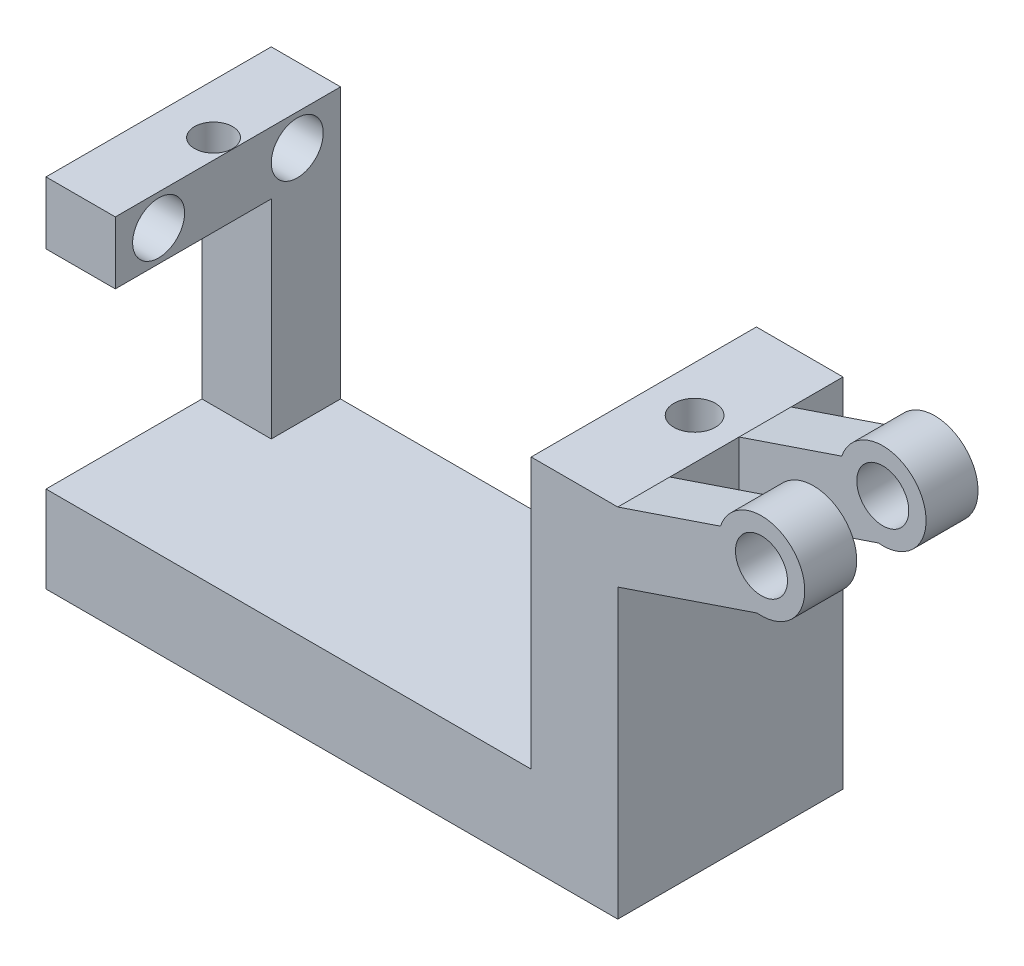
from build123d import *

# Parameters (mm, degrees)
BOSS_EXTRUDE1_DEPTH            = 13
SKETCH2_W                      = 9
SKETCH2_H                      = 12
CUT_EXTRUDE1_DEPTH             = 5
SKETCH3_R                      = 1.1
SKETCH3_R_2                    = 1.2
CUT_EXTRUDE2_DEPTH             = 5
SKETCH4_R                      = 1.5
BOSS_EXTRUDE3_DEPTH            = 3
BOSS_EXTRUDE4_START            = -6
BOSS_EXTRUDE4_OUTLINE_R        = 1.5
BOSS_EXTRUDE4_DEPTH            = 3
CUT_EXTRUDE3_REACH             = 53.746
SKETCH9_R                      = 1.5
CUT_EXTRUDE3_DIRECTION_2_DEPTH = 52.745889594
SKETCH10_W                     = 1
SKETCH10_H                     = 15.6
CUT_EXTRUDE5_DEPTH             = 39.790984582


# Read off the part's stored shape, not the designer's step: Boss-Extrude4
with BuildPart() as part:
    # Sketch1 → Boss-Extrude1 (new body)
    with BuildSketch(Plane.XY):
        Polygon((-11.5, 0), (11.5, 0), (16.5, 0), (16.5, 20.6), (11.5, 20.6), (11.5, 5), (-11.5, 5), (-11.5, 20.6), (-16.5, 20.6), (-16.5, 0), align=None)
    extrude(amount=BOSS_EXTRUDE1_DEPTH)

    # Sketch2 → Cut-Extrude1 (cut)
    with BuildSketch(Plane(origin=(-11.5, 0, 0), x_dir=(0, 0, -1), z_dir=(1, 0, 0))):
        with Locations((-8.5, 11)):
            Rectangle(SKETCH2_W, SKETCH2_H)
    extrude(amount=-CUT_EXTRUDE1_DEPTH, mode=Mode.SUBTRACT)

    # Sketch3 → Cut-Extrude2 (cut)
    with BuildSketch(Plane(origin=(0, 20.6, 0), x_dir=(1, 0, 0), z_dir=(0, 1, 0))):
        with Locations(Location((-13.63, -6.2, 0), (0, 0, 180))):
            Circle(SKETCH3_R)
        with Locations((14.132964109, -6.2)):
            Circle(SKETCH3_R_2)
    extrude(amount=-CUT_EXTRUDE2_DEPTH, mode=Mode.SUBTRACT)

    # Sketch4 → Boss-Extrude3 (add)
    with BuildSketch(Plane.XY.offset(13)):
        with BuildLine():
            Line((22.42265834, 22.604489903), (16.5, 20.6))
            Line((16.5, 20.6), (16.5, 16.600005885))
            Line((16.5, 16.600005885), (24.538834173, 19.320695429))
            ThreePointArc((24.538834173, 19.320695429), (26.893762727, 23.162043036), (22.42265834, 22.604489903))
        make_face()
        with Locations((24.792321364, 21.807811077)):
            Circle(SKETCH4_R, mode=Mode.SUBTRACT)
    extrude(amount=-BOSS_EXTRUDE3_DEPTH)

    # Boss-Extrude4 outline → Boss-Extrude4 (add)
    with BuildSketch(Plane(origin=(0, 0, 0), x_dir=(-1, 0, 0), z_dir=(0, 0, -1)).offset(BOSS_EXTRUDE4_START)):
        with BuildLine():
            Line((-16.499998213, 20.600005281), (-22.42265834, 22.604489903))
            ThreePointArc((-22.42265834, 22.604489903), (-26.893762727, 23.162043036), (-24.538834173, 19.320695429))
            Line((-24.538834173, 19.320695429), (-16.5, 16.600005885))
            Line((-16.5, 16.600005885), (-16.499998213, 20.600005281))
        make_face()
        with Locations((-24.792321364, 21.807811077)):
            Circle(BOSS_EXTRUDE4_OUTLINE_R, mode=Mode.SUBTRACT)
    extrude(amount=BOSS_EXTRUDE4_DEPTH)

    # Sketch9 → Cut-Extrude3 (cut, up to next)
    with BuildSketch(Plane.ZY.offset(16.5), mode=Mode.PRIVATE) as cut_extrude3_sk1:
        with Locations(Location((2.5, 18.8, 0), (0, 0, 90))):
            Circle(SKETCH9_R)
    cut_extrude3_tool1 = extrude(cut_extrude3_sk1.sketch, amount=-CUT_EXTRUDE3_REACH, mode=Mode.PRIVATE) & part.part
    # Sketch9 → Cut-Extrude3 (cut, up to next)
    with BuildSketch(Plane.ZY.offset(16.5), mode=Mode.PRIVATE) as cut_extrude3_sk2:
        with Locations(Location((10.5, 18.8, 0), (0, 0, 90))):
            Circle(SKETCH9_R)
    cut_extrude3_tool2 = extrude(cut_extrude3_sk2.sketch, amount=-CUT_EXTRUDE3_REACH, mode=Mode.PRIVATE) & part.part
    add(cut_extrude3_tool1.solids().sort_by_distance((-16.5, 18.8, 2.5))[0], mode=Mode.SUBTRACT)
    add(cut_extrude3_tool2.solids().sort_by_distance((-16.5, 18.8, 10.5))[0], mode=Mode.SUBTRACT)

    # Sketch9 → Cut-Extrude3 direction 2 (cut)
    with BuildSketch(Plane.ZY.offset(16.5)):
        with Locations(Location((2.5, 18.8, 0), (0, 0, 90))):
            Circle(SKETCH9_R)
        with Locations(Location((10.5, 18.8, 0), (0, 0, 90))):
            Circle(SKETCH9_R)
    extrude(amount=CUT_EXTRUDE3_DIRECTION_2_DEPTH, mode=Mode.SUBTRACT)

    # Sketch10 → Cut-Extrude5 (cut, through all)
    with BuildSketch(Plane.XY.offset(13)):
        with Locations((-12, 12.8)):
            Rectangle(SKETCH10_W, SKETCH10_H)
    extrude(amount=-CUT_EXTRUDE5_DEPTH, mode=Mode.SUBTRACT)


solid = part.part
